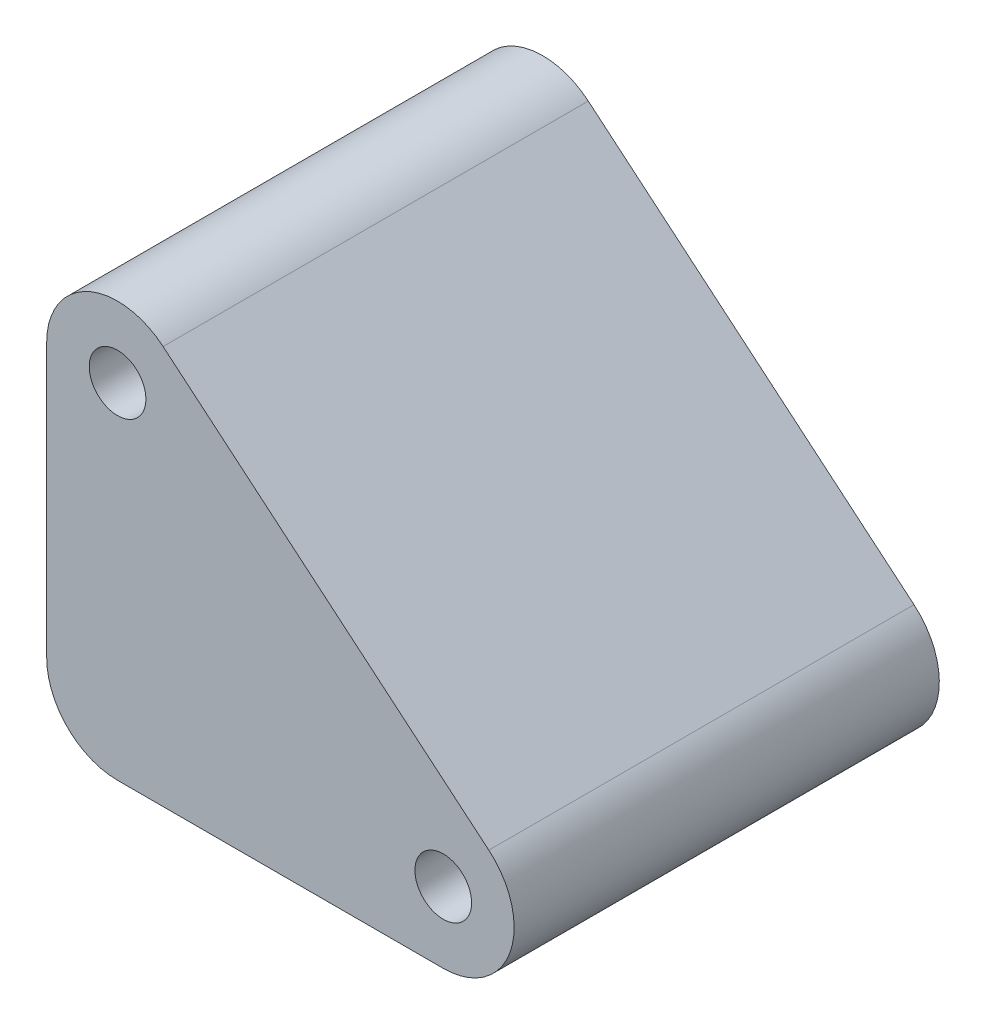
from build123d import *

# Parameters (mm, degrees)
BOSS_EXTRUDE1_DEPTH      = 15
BOSS_EXTRUDE1_DEPTH_BACK = 15
SKETCH1_R                = 2


with BuildPart() as part:
    # Sketch1 → Boss-Extrude1 (new, two sides: drawn at the far end of the back side and taken through both)
    with BuildSketch(Plane.XY.offset(-BOSS_EXTRUDE1_DEPTH_BACK)):
        with BuildLine():
            Line((-261.50460572, 29.701290865), (-238.523272426, 10.417662574))
            ThreePointArc((-238.523272426, 10.417662574), (-237.038747371, 4.877339642), (-241.737210475, 1.587440358))
            Line((-241.737210475, 1.587440358), (-264.718543768, 1.587440358))
            ThreePointArc((-264.718543768, 1.587440358), (-268.254077674, 3.051906453), (-269.718543768, 6.587440358))
            Line((-269.718543768, 6.587440358), (-269.718543768, 25.871068649))
            ThreePointArc((-269.718543768, 25.871068649), (-266.831635077, 30.402607584), (-261.50460572, 29.701290865))
        make_face()
        with Locations((-264.718543768, 25.871068649)):
            Circle(SKETCH1_R, mode=Mode.SUBTRACT)
        with Locations((-241.737210475, 6.587440358)):
            Circle(SKETCH1_R, mode=Mode.SUBTRACT)
    extrude(amount=BOSS_EXTRUDE1_DEPTH + BOSS_EXTRUDE1_DEPTH_BACK)


solid = part.part
